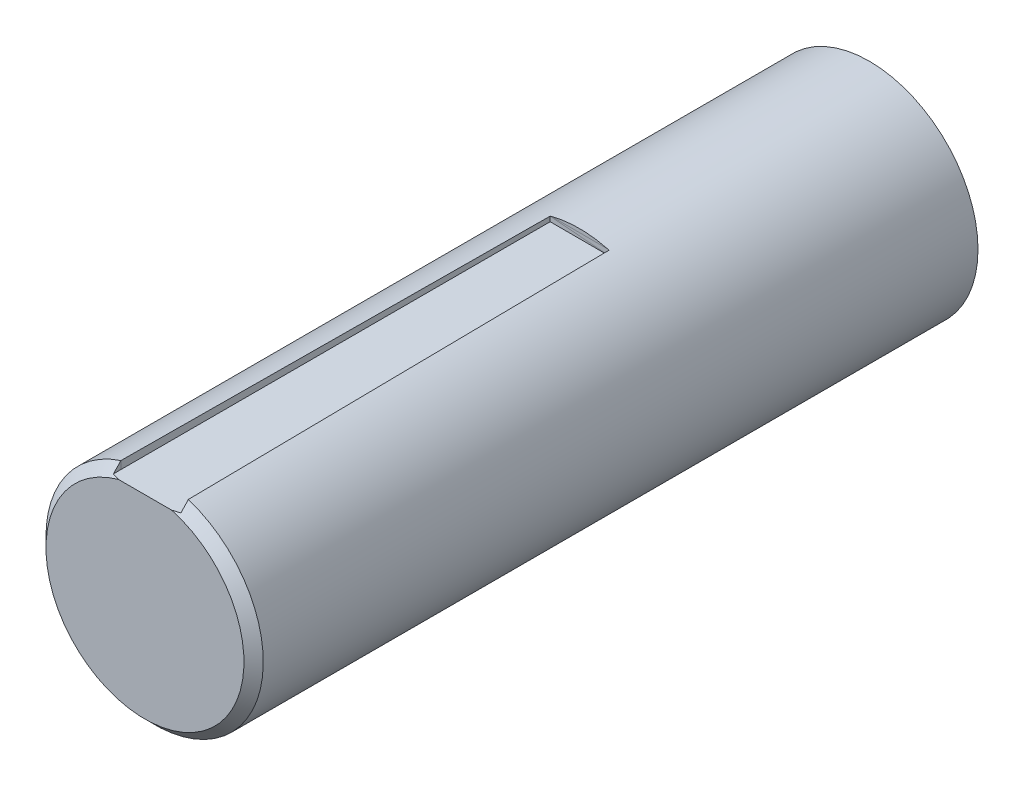
from build123d import *

# Parameters (mm, degrees)
SKETCH1_R           = 22.5
BOSS_EXTRUDE1_DEPTH = 150
CHAMFER1_SIZE       = 2
SKETCH3_W           = 14
SKETCH3_H           = 2.888024264
CUT_EXTRUDE6_DEPTH  = 90
CUT_EXTRUDE6_DRAFT  = -0.57
CUT_EXTRUDE7_DEPTH  = 21


with BuildPart() as part:
    # Sketch1 → Boss-Extrude1 (new body)
    with BuildSketch(Plane.XY):
        Circle(SKETCH1_R)
    extrude(amount=BOSS_EXTRUDE1_DEPTH)

    # Chamfer1
    chamfer1_edges = [part.edges().sort_by_distance(p)[0] for p in [
        (-22.5, 0, 150),
    ]]
    chamfer(chamfer1_edges, length=CHAMFER1_SIZE)


with BuildPart() as cut_extrude6_tool:
    # Sketch3 → Cut-Extrude6 (with draft: the straight prism first)
    with BuildSketch(Plane.XY.offset(150)):
        with Locations((0, 21.194012132)):
            Rectangle(SKETCH3_W, SKETCH3_H)
    extrude(amount=-CUT_EXTRUDE6_DEPTH)
    # Cut-Extrude6: the draft: its side faces are tilted about the plane it starts from
    cut_extrude6_sides = [cut_extrude6_tool.faces().sort_by_distance(p)[0] for p in [
        (7, 21.194012132, 105),
        (0, 22.638024264, 105),
        (-7, 21.194012132, 105),
        (0, 19.75, 105),
    ]]
    draft(cut_extrude6_sides, Plane.XY.offset(150), CUT_EXTRUDE6_DRAFT)


with BuildPart() as part_1:
    add(part.part)

    # Cut-Extrude6: cut by cut_extrude6_tool
    add(cut_extrude6_tool.part, mode=Mode.SUBTRACT)

    # Sketch6 → Cut-Extrude7 (cut)
    with BuildSketch(Plane(origin=(0, 21.240203456, 0.211312517), x_dir=(1, 0, 0), z_dir=(0, 0.9999505153082836, 0.009948212638374379))):
        Polygon((-6.98010259, -147.779884912), (6.98010259, -147.779884912), (6.104616555, -59.791646254), (-6.104616555, -59.781592122), align=None)
    extrude(amount=CUT_EXTRUDE7_DEPTH, mode=Mode.SUBTRACT)


solid = part_1.part
